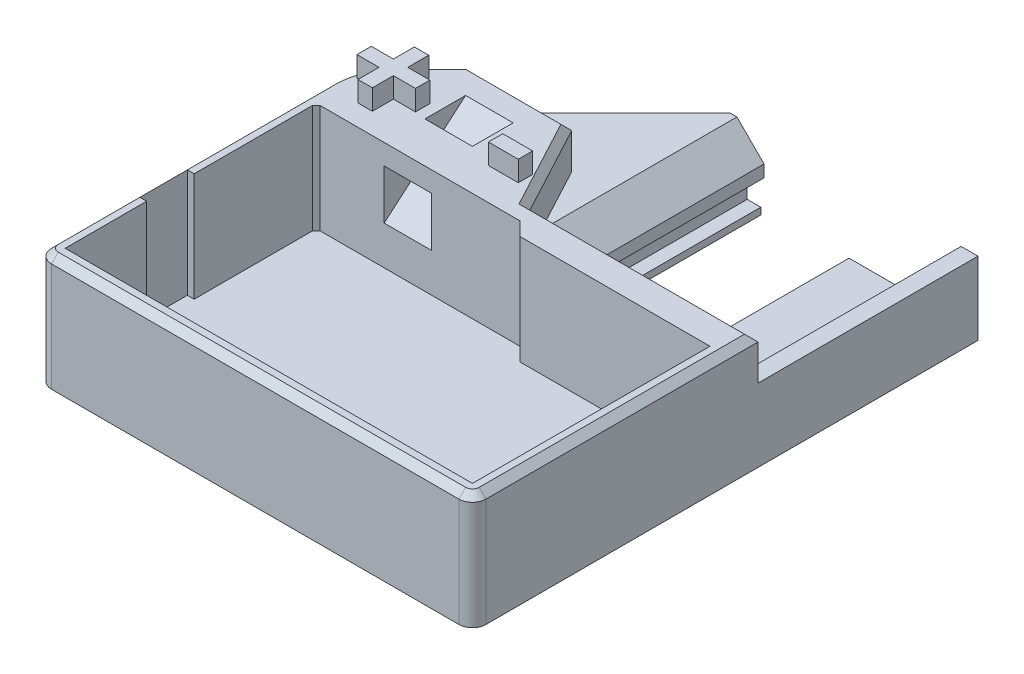
from build123d import *

# Parameters (mm, degrees)
SKETCH1_W           = 60
SKETCH1_H           = 75
BOSS_EXTRUDE1_DEPTH = 1
SKETCH2_W           = 64
SKETCH2_H           = 79
SKETCH2_W_2         = 60
SKETCH2_H_2         = 75
BOSS_EXTRUDE2_DEPTH = 17
SKETCH3_W           = 60
SKETCH3_H           = 40
BOSS_EXTRUDE3_DEPTH = 16
SKETCH4_W           = 1
SKETCH4_H           = 7
CUT_EXTRUDE1_DEPTH  = 16
CUT_LOFT2_START     = -20
CUT_LOFT2_DEPTH     = 7
SKETCH7_W           = 21.435869032
SKETCH7_H           = 2
CUT_EXTRUDE2_DEPTH  = 16
CHAMFER1_SIZE       = 10
CHAMFER2_SIZE       = 2
SKETCH9_W           = 30
SKETCH9_H           = 27.5
CUT_EXTRUDE3_DEPTH  = 14
SKETCH10_W          = 2
SKETCH10_H          = 2
BOSS_EXTRUDE5_DEPTH = 7
CUT_EXTRUDE4_DEPTH  = 54.602705156
FILLET1_R           = 10
FILLET2_R           = 10
FILLET3_R           = 2
SKETCH13_W          = 4.396153847
SKETCH13_H          = 2.116666667
BOSS_EXTRUDE7_DEPTH = 3
SKETCH14_W          = 15
SKETCH14_H          = 21.25
CUT_EXTRUDE5_DEPTH  = 52.809748118
CUT_EXTRUDE6_DEPTH  = 9
SKETCH16_W          = 15
SKETCH16_H          = 17.83101705
CUT_EXTRUDE7_DEPTH  = 54.602705156
BOSS_EXTRUDE8_REACH = 62.665
SKETCH18_W          = 40.424998059
SKETCH18_H          = 8.849345581
CUT_EXTRUDE8_DEPTH  = 54.602705156
CUT_EXTRUDE9_DEPTH  = 6.246782155
CHAMFER3_SIZE       = 1
CHAMFER4_SIZE       = 4
SKETCH20_W          = 2
SKETCH20_H          = 1
BOSS_EXTRUDE9_DEPTH = 26.984954309


# Read off the part's stored shape, not the designer's step: Cut-Loft2
# Some blends are built 0.0001 mm under size
with BuildPart() as part:
    # Sketch1 → Boss-Extrude1 (new body)
    with BuildSketch(Plane(origin=(0, 0, 0), x_dir=(1, 0, 0), z_dir=(0, 1, 0))):
        Rectangle(SKETCH1_W, SKETCH1_H)
    extrude(amount=BOSS_EXTRUDE1_DEPTH)

    # Sketch2 → Boss-Extrude2 (add)
    with BuildSketch(Plane.XZ):
        Rectangle(SKETCH2_W, SKETCH2_H)
        Rectangle(SKETCH2_W_2, SKETCH2_H_2, mode=Mode.SUBTRACT)
    extrude(amount=-BOSS_EXTRUDE2_DEPTH)

    # Sketch3 → Boss-Extrude3 (add)
    with BuildSketch(Plane(origin=(0, 1, 0), x_dir=(1, 0, 0), z_dir=(0, 1, 0))):
        with Locations((0, 17.5)):
            Rectangle(SKETCH3_W, SKETCH3_H)
    extrude(amount=BOSS_EXTRUDE3_DEPTH)

    # Sketch4 → Cut-Extrude1 (cut)
    with BuildSketch(Plane(origin=(0, 17, 0), x_dir=(1, 0, 0), z_dir=(0, 1, 0))):
        with Locations((-30.5, -22)):
            Rectangle(SKETCH4_W, SKETCH4_H)
    extrude(amount=-CUT_EXTRUDE1_DEPTH, mode=Mode.SUBTRACT)

    # Cut-Loft2 outline → Cut-Loft2 (cut)
    with BuildSketch(Plane.YZ.offset(CUT_LOFT2_START)):
        Polygon((17, -5.5), (13, 2.5), (5, 2.5), (17, -11.5), align=None)
    extrude(amount=CUT_LOFT2_DEPTH, mode=Mode.SUBTRACT)

    # Sketch7 → Cut-Extrude2 (cut)
    with BuildSketch(Plane(origin=(0, 17, 0), x_dir=(1, 0, 0), z_dir=(0, 1, 0))):
        with Locations((-10.717934516, -1.5)):
            Rectangle(SKETCH7_W, SKETCH7_H)
    extrude(amount=-CUT_EXTRUDE2_DEPTH, mode=Mode.SUBTRACT)

    # Chamfer1
    # the kernel refuses this chamfer: 10 mm, written as the material it takes off along each edge
    with BuildSketch(Plane(origin=(-21.435869032, 42.71682988, 2.5), x_dir=(-0.9996219169112968, 0, 0.02749587661058636), z_dir=(0, -1, 0))) as chamfer1_piece_1_section:
        Polygon((CHAMFER1_SIZE * 0.999621916911, CHAMFER1_SIZE * 0.0274958766106), (-CHAMFER1_SIZE * 0.0274958766106, CHAMFER1_SIZE * 0.999621916911), (0, 0), align=None)
    chamfer1_piece_1 = extrude(amount=41.71682988, mode=Mode.PRIVATE)
    chamfer1_piece_1 = split(chamfer1_piece_1, bisect_by=Plane(origin=(-30, 9, 1.507613822), z_dir=(1, 0, 0)), keep=Keep.TOP, mode=Mode.PRIVATE)
    chamfer1_piece_1 = split(chamfer1_piece_1, bisect_by=Plane(origin=(-25.679544331, 9, 0.5), z_dir=(0, 0, 1)), keep=Keep.TOP, mode=Mode.PRIVATE)
    add(chamfer1_piece_1, mode=Mode.SUBTRACT)

    # Chamfer2
    chamfer2_edges = [part.edges().sort_by_distance(p)[0] for p in [
        (0, 9, 2.5),
    ]]
    chamfer(chamfer2_edges, length=CHAMFER2_SIZE - 0.0001)  # a hair under: the kernel refuses the full size

    # Sketch9 → Cut-Extrude3 (cut)
    with BuildSketch(Plane(origin=(0, 17, 0), x_dir=(1, 0, 0), z_dir=(0, 1, 0))):
        with Locations((13, 21.75)):
            Rectangle(SKETCH9_W, SKETCH9_H)
    extrude(amount=-CUT_EXTRUDE3_DEPTH, mode=Mode.SUBTRACT)

    # Sketch10 → Boss-Extrude5 (add)
    with BuildSketch(Plane(origin=(0, 3, 0), x_dir=(1, 0, 0), z_dir=(0, 1, 0))):
        Polygon((-2, 23), (10, 23), (10, 8), (28, 8), (28, 35.5), (-2, 35.5), align=None)
        with Locations((-1, 9)):
            Rectangle(SKETCH10_W, SKETCH10_H)
    extrude(amount=BOSS_EXTRUDE5_DEPTH)

    # Sketch11 → Cut-Extrude4 (cut, through all)
    with BuildSketch(Plane(origin=(0, 17, 0), x_dir=(1, 0, 0), z_dir=(0, 1, 0))):
        Polygon((0, 39.5), (-32, 7.5), (-32, 39.5), align=None)
    extrude(amount=-CUT_EXTRUDE4_DEPTH, mode=Mode.SUBTRACT)

    # Fillet1
    fillet1_edges = [part.edges().sort_by_distance(p)[0] for p in [
        (-32, 8.5, -7.5),
    ]]
    fillet(fillet1_edges, radius=FILLET1_R)

    # Fillet2
    fillet2_edges = [part.edges().sort_by_distance(p)[0] for p in [
        (0, 8.5, -39.5),
    ]]
    fillet(fillet2_edges, radius=FILLET2_R)

    # Fillet3
    fillet3_edges = [part.edges().sort_by_distance(p)[0] for p in [
        (32, 8.5, -39.5),
        (-32, 8.5, 39.5),
        (32, 8.5, 39.5),
    ]]
    fillet(fillet3_edges, radius=FILLET3_R)

    # Sketch13 → Boss-Extrude7 (add)
    with BuildSketch(Plane(origin=(0, 17, 0), x_dir=(1, 0, 0), z_dir=(0, 1, 0))):
        Polygon((-26.96363203, 7.819559599), (-26.96363203, 10.913149343), (-24.846965364, 10.913149343), (-24.846965364, 7.819559599), (-21.590555107, 7.819559599), (-21.590555107, 5.702892932), (-24.846965364, 5.702892932), (-24.846965364, 2.609303189), (-26.96363203, 2.609303189), (-26.96363203, 5.702892932), (-30.220042287, 5.702892932), (-30.220042287, 7.819559599), align=None)
        with Locations((-7.180939722, 5.29584165)):
            Rectangle(SKETCH13_W, SKETCH13_H)
    extrude(amount=BOSS_EXTRUDE7_DEPTH)

    # Sketch14 → Cut-Extrude5 (cut, through all)
    with BuildSketch(Plane(origin=(0, 10, 0), x_dir=(1, 0, 0), z_dir=(0, 1, 0))):
        with Locations((5.5, 18.625)):
            Rectangle(SKETCH14_W, SKETCH14_H)
    extrude(amount=-CUT_EXTRUDE5_DEPTH, mode=Mode.SUBTRACT)

    # Sketch15 → Cut-Extrude6 (cut)
    with BuildSketch(Plane(origin=(0, 10, 0), x_dir=(1, 0, 0), z_dir=(0, 1, 0))):
        Polygon((-2, 29.25), (13, 29.25), (13, 8), (28, 8), (28, 35.5), (-2, 35.5), align=None)
    extrude(amount=-CUT_EXTRUDE6_DEPTH, mode=Mode.SUBTRACT)

    # Sketch16 → Cut-Extrude7 (cut, through all)
    with BuildSketch(Plane(origin=(0, 17, 0), x_dir=(1, 0, 0), z_dir=(0, 1, 0))):
        with BuildLine():
            Line((-2, 37.391398481), (-2, 35.5))
            Line((-2, 35.5), (13, 35.5))
            Line((13, 35.5), (28, 35.5))
            Line((28, 35.5), (28, 39.5))
            Line((28, 39.5), (4.142135624, 39.5))
            ThreePointArc((4.142135624, 39.5), (0.89513584, 38.958170669), (-2, 37.391398481))
        make_face()
        with BuildLine():
            Line((-2, 41.583442656), (-2, 37.391398481))
            ThreePointArc((-2, 37.391398481), (0.89513584, 38.958170669), (4.142135624, 39.5))
            Line((4.142135624, 39.5), (28, 39.5))
            Line((28, 39.5), (28, 41.583442656))
            Line((28, 41.583442656), (-2, 41.583442656))
        make_face()
        with Locations((5.5, 26.584491475)):
            Rectangle(SKETCH16_W, SKETCH16_H)
    extrude(amount=-CUT_EXTRUDE7_DEPTH, mode=Mode.SUBTRACT)

    # Boss-Extrude8: up to this face of the body (flat: up to its plane)
    boss_extrude8_end = Plane(part.part.faces().sort_by_distance((29, 8.5, -39.5))[0])
    # Sketch17 → Boss-Extrude8 (add, up to the picked face)
    with BuildSketch(Plane(origin=(0, 0, -8), x_dir=(-1, 0, 0), z_dir=(0, 0, -1)), mode=Mode.PRIVATE) as boss_extrude8_sk1:
        Polygon((-28, 2.5), (-25.515371071, 4.984628929), (-25.515371071, 10.753217845), (-28, 10.753217845), align=None)
    boss_extrude8_tool1 = split(extrude(boss_extrude8_sk1.sketch, amount=BOSS_EXTRUDE8_REACH, mode=Mode.PRIVATE), bisect_by=boss_extrude8_end, keep=Keep.BOTH, mode=Mode.PRIVATE)
    # Sketch17 → Boss-Extrude8 (add, up to the picked face)
    with BuildSketch(Plane(origin=(0, 0, -8), x_dir=(-1, 0, 0), z_dir=(0, 0, -1)), mode=Mode.PRIVATE) as boss_extrude8_sk2:
        Polygon((2, 2.5), (-0.484628929, 4.984628929), (-0.484628929, 10.753217845), (2, 10.753217845), align=None)
    boss_extrude8_tool2 = split(extrude(boss_extrude8_sk2.sketch, amount=BOSS_EXTRUDE8_REACH, mode=Mode.PRIVATE), bisect_by=boss_extrude8_end, keep=Keep.BOTH, mode=Mode.PRIVATE)
    add(boss_extrude8_tool1.solids().sort_by(Axis((26.831064, 7.211077, -8), (0, 0, -1)))[0])
    add(boss_extrude8_tool2.solids().sort_by(Axis((-0.831064, 7.211077, -8), (0, 0, -1)))[0])

    # Sketch18 → Cut-Extrude8 (cut, through all)
    with BuildSketch(Plane(origin=(0, 17, 0), x_dir=(1, 0, 0), z_dir=(0, 1, 0))):
        with Locations((11.787500971, 39.409627099)):
            Rectangle(SKETCH18_W, SKETCH18_H)
    extrude(amount=-CUT_EXTRUDE8_DEPTH, mode=Mode.SUBTRACT)

    # Sketch19 → Cut-Extrude9 (cut)
    with BuildSketch(Plane(origin=(0, 17, 0), x_dir=(1, 0, 0), z_dir=(0, 1, 0))):
        Polygon((28, 34.984954309), (28, 8), (-2, 8), (-2, 34.984954309), (-4.515045691, 34.984954309), (-23.671563877, 15.828436123), (-8.697697865, 15.828436123), (-4.515045691, 8), (-1.618603226, 2.578890647), (32, 2.578890647), (32, 34.984954309), align=None)
    extrude(amount=-CUT_EXTRUDE9_DEPTH, mode=Mode.SUBTRACT)

    # Chamfer3
    # the kernel refuses this chamfer: 1 mm, written as the material it takes off along each edge
    with BuildSketch(Plane(origin=(-21.853109397, 17, -17.646890603), x_dir=(0.7068394360706796, 0.02749587661058563, 0.7068394360706675), z_dir=(-0.7071067811865415, 0, 0.7071067811865536))) as chamfer3_piece_1:
        Polygon((CHAMFER3_SIZE * 0.999621916911, -CHAMFER3_SIZE * 0.0274958766106), (-CHAMFER3_SIZE * 0.0274958766106, -CHAMFER3_SIZE * 0.999621916911), (0, 0), align=None)
    extrude(amount=10.207734683, mode=Mode.SUBTRACT)
    with BuildSketch(Plane(origin=(-22, 17, -3.357864376), x_dir=(-0.7071067811865538, 0, -0.7071067811865412), z_dir=(0.7071067811865412, 0, -0.7071067811865538))) as chamfer3_piece_2_section:
        Polygon((10 - CHAMFER3_SIZE, 0), (10, -CHAMFER3_SIZE), (10, 0), align=None)
    chamfer3_piece_2 = revolve(axis=Axis((-22, 17, -3.357864376), (0, 1, 0)), revolution_arc=45, mode=Mode.PRIVATE)
    chamfer3_piece_2 = split(chamfer3_piece_2, bisect_by=Plane(origin=(-29.540972518, 16.686713644, -7.819559599), z_dir=(0, 0, -1)), keep=Keep.TOP, mode=Mode.PRIVATE)
    chamfer3_piece_2 = split(chamfer3_piece_2, bisect_by=Plane(origin=(-30.220042287, 16.686713644, -9.324246754), z_dir=(1, 0, 0)), keep=Keep.TOP, mode=Mode.PRIVATE)
    add(chamfer3_piece_2, mode=Mode.SUBTRACT)
    with BuildSketch(Plane(origin=(-22, 17, -3.357864376), x_dir=(-0.7071067811865538, 0, -0.7071067811865412), z_dir=(0.7071067811865412, 0, -0.7071067811865538))) as chamfer3_piece_3_section:
        Polygon((10 - CHAMFER3_SIZE, 0), (10, -CHAMFER3_SIZE), (10, 0), align=None)
    chamfer3_piece_3 = revolve(axis=Axis((-22, 17, -3.357864376), (0, 1, 0)), revolution_arc=45, mode=Mode.PRIVATE)
    chamfer3_piece_3 = split(chamfer3_piece_3, bisect_by=Plane(origin=(-30.497975993, 16.585042802, -7.819559599), z_dir=(0, 0, -1)), keep=Keep.TOP, mode=Mode.PRIVATE)
    chamfer3_piece_3 = split(chamfer3_piece_3, bisect_by=Plane(origin=(-30.220042287, 16.585042802, -8.286119393), z_dir=(-1, 0, 0)), keep=Keep.TOP, mode=Mode.PRIVATE)
    add(chamfer3_piece_3, mode=Mode.SUBTRACT)
    with BuildSketch(Plane(origin=(-22, 17, -3.357864376), x_dir=(-0.7071067811865538, 0, -0.7071067811865412), z_dir=(0.7071067811865412, 0, -0.7071067811865538))) as chamfer3_piece_4_section:
        Polygon((10 - CHAMFER3_SIZE, 0), (10, -CHAMFER3_SIZE), (10, 0), align=None)
    chamfer3_piece_4 = revolve(axis=Axis((-22, 17, -3.357864376), (0, 1, 0)), revolution_arc=45, mode=Mode.PRIVATE)
    chamfer3_piece_4 = split(chamfer3_piece_4, bisect_by=Plane(origin=(-31.314504081, 16.6678644, -7.819559599), z_dir=(0, 0, 1)), keep=Keep.TOP, mode=Mode.PRIVATE)
    chamfer3_piece_4 = split(chamfer3_piece_4, bisect_by=Plane(origin=(-30.220042287, 16.6678644, -5.613397868), z_dir=(-1, 0, 0)), keep=Keep.TOP, mode=Mode.PRIVATE)
    add(chamfer3_piece_4, mode=Mode.SUBTRACT)
    with BuildSketch(Plane(origin=(30, 17, 39.5), x_dir=(0, 0.02749587661058555, -0.9996219169112968), z_dir=(-1, 0, 0))) as chamfer3_piece_5:
        Polygon((CHAMFER3_SIZE * 0.999621916911, CHAMFER3_SIZE * 0.0274958766106), (-CHAMFER3_SIZE * 0.0274958766106, CHAMFER3_SIZE * 0.999621916911), (0, 0), align=None)
    extrude(amount=60, mode=Mode.SUBTRACT)
    with BuildSketch(Plane(origin=(-32, 17, 37.5), x_dir=(0.9996219169112968, 0.027495876610585647, 0), z_dir=(0, 0, -1))) as chamfer3_piece_6:
        Polygon((CHAMFER3_SIZE * 0.999621916911, CHAMFER3_SIZE * 0.0274958766106), (-CHAMFER3_SIZE * 0.0274958766106, CHAMFER3_SIZE * 0.999621916911), (0, 0), align=None)
    extrude(amount=40.857864376, mode=Mode.SUBTRACT)
    with BuildSketch(Plane(origin=(30, 17, 37.5), x_dir=(1, 0, 0), z_dir=(0, 0, -1))) as chamfer3_piece_7:
        Polygon((2 - CHAMFER3_SIZE, 0), (2, CHAMFER3_SIZE), (2, 0), align=None)
    revolve(axis=Axis((30, 17, 37.5), (0, -1, 0)), revolution_arc=90, mode=Mode.SUBTRACT)
    with BuildSketch(Plane(origin=(-30, 17, 37.5), x_dir=(-1, 0, 0), z_dir=(0, 0, -1))) as chamfer3_piece_8:
        Polygon((2 - CHAMFER3_SIZE, 0), (2, -CHAMFER3_SIZE), (2, 0), align=None)
    revolve(axis=Axis((-30, 17, 37.5), (0, 1, 0)), revolution_arc=90, mode=Mode.SUBTRACT)
    with BuildSketch(Plane(origin=(32, 17, -5.150573635), x_dir=(-0.9996219169112968, 0.027495876610585647, 0), z_dir=(0, 0, 1))) as chamfer3_piece_9:
        Polygon((CHAMFER3_SIZE * 0.999621916911, CHAMFER3_SIZE * 0.0274958766106), (-CHAMFER3_SIZE * 0.0274958766106, CHAMFER3_SIZE * 0.999621916911), (0, 0), align=None)
    extrude(amount=42.650573635, mode=Mode.SUBTRACT)
    with BuildSketch(Plane(origin=(-26.243246865, 17, -15.828436123), x_dir=(0, 0.027495876610585647, 0.9996219169112968), z_dir=(1, 0, 0))) as chamfer3_piece_10:
        Polygon((CHAMFER3_SIZE * 0.999621916911, CHAMFER3_SIZE * 0.0274958766106), (-CHAMFER3_SIZE * 0.0274958766106, CHAMFER3_SIZE * 0.999621916911), (0, 0), align=None)
    extrude(amount=20.117231987, mode=Mode.SUBTRACT)
    with BuildSketch(Plane(origin=(-0.40671107, 17, -0.310659884), x_dir=(-0.8816690057056329, 0.02749587661058563, 0.47106659948191654), z_dir=(-0.4712447691597757, 0, -0.8820024759259748))) as chamfer3_piece_11_section:
        Polygon((CHAMFER3_SIZE * 0.999621916911, -CHAMFER3_SIZE * 0.0274958766106), (-CHAMFER3_SIZE * 0.0274958766106, -CHAMFER3_SIZE * 0.999621916911), (0, 0), align=None)
    chamfer3_piece_11 = extrude(amount=20.16548421, mode=Mode.PRIVATE)
    chamfer3_piece_11 = split(chamfer3_piece_11, bisect_by=Plane(origin=(-6.094530001, 16.669164986, -2.578890647), z_dir=(0, 0, -1)), keep=Keep.TOP, mode=Mode.PRIVATE)
    add(chamfer3_piece_11, mode=Mode.SUBTRACT)
    with BuildSketch(Plane(origin=(-4.190286214, 17, -2.578890647), x_dir=(0, 0.02749587661058563, 0.9996219169112968), z_dir=(1, 0, 0))) as chamfer3_piece_12_section:
        Polygon((CHAMFER3_SIZE * 0.999621916911, CHAMFER3_SIZE * 0.0274958766106), (-CHAMFER3_SIZE * 0.0274958766106, CHAMFER3_SIZE * 0.999621916911), (0, 0), align=None)
    chamfer3_piece_12 = extrude(amount=38.761969201, mode=Mode.PRIVATE)
    chamfer3_piece_12 = split(chamfer3_piece_12, bisect_by=Plane(origin=(2.556007493, 16.669702724, 5.234494733), z_dir=(0.8820024759259748, 0, -0.47124476915977576)), keep=Keep.TOP, mode=Mode.PRIVATE)
    add(chamfer3_piece_12, mode=Mode.SUBTRACT)
    with BuildSketch(Plane(origin=(-4.190286214, 17, -2.578890647), x_dir=(0, 0.02749587661058563, 0.9996219169112968), z_dir=(1, 0, 0))) as chamfer3_piece_13a_section:
        Polygon((CHAMFER3_SIZE * 0.999621916911, CHAMFER3_SIZE * 0.0274958766106), (-CHAMFER3_SIZE * 0.0274958766106, CHAMFER3_SIZE * 0.999621916911), (0, 0), align=None)
    chamfer3_piece_13a = extrude(amount=38.761969201, mode=Mode.PRIVATE)
    chamfer3_piece_13a = split(chamfer3_piece_13a, bisect_by=Plane(origin=(-1.74164745, 16.676807244, -2.80918564), z_dir=(-0.8820024759259748, 0, 0.47124476915977576)), keep=Keep.TOP, mode=Mode.PRIVATE)
    with BuildSketch(Plane(origin=(-0.40671107, 17, -0.310659884), x_dir=(-0.8816690057056329, 0.02749587661058563, 0.47106659948191654), z_dir=(-0.4712447691597757, 0, -0.8820024759259748))) as chamfer3_piece_13b_section:
        Polygon((CHAMFER3_SIZE * 0.999621916911, -CHAMFER3_SIZE * 0.0274958766106), (-CHAMFER3_SIZE * 0.0274958766106, -CHAMFER3_SIZE * 0.999621916911), (0, 0), align=None)
    chamfer3_piece_13b = extrude(amount=20.16548421, mode=Mode.PRIVATE)
    chamfer3_piece_13b = split(chamfer3_piece_13b, bisect_by=Plane(origin=(-1.357498525, 16.676807244, -2.578890647), z_dir=(0, 0, 1)), keep=Keep.TOP, mode=Mode.PRIVATE)
    chamfer3_piece_13 = chamfer3_piece_13a & chamfer3_piece_13b
    add(chamfer3_piece_13, mode=Mode.SUBTRACT)

    # Chamfer4
    # the kernel refuses this chamfer: 4 mm, written as the material it takes off along each edge
    with BuildSketch(Plane(origin=(0.484628929, 10.753217845, -8), x_dir=(0.02749587660983432, -0.9996219169113173, 0), z_dir=(0, 0, -1))) as chamfer4_piece_1:
        Polygon((CHAMFER4_SIZE * 0.999621916911, CHAMFER4_SIZE * 0.0274958766098), (-CHAMFER4_SIZE * 0.0274958766631, CHAMFER4_SIZE * 0.99962191691), (0, 0), align=None)
    extrude(amount=37.271686261, mode=Mode.SUBTRACT)
    with BuildSketch(Plane(origin=(25.515371071, 10.753217845, -8), x_dir=(-0.027495876609834723, -0.9996219169113173, 0), z_dir=(0, 0, -1))) as chamfer4_piece_2:
        Polygon((CHAMFER4_SIZE * 0.999621916911, -CHAMFER4_SIZE * 0.0274958766098), (-CHAMFER4_SIZE * 0.0274958766631, -CHAMFER4_SIZE * 0.99962191691), (0, 0), align=None)
    extrude(amount=37.271686261, mode=Mode.SUBTRACT)
    with BuildSketch(Plane(origin=(25.515371071, 10.753217845, -8), x_dir=(0, -0.9996219169112968, -0.027495876610586494), z_dir=(-1, 0, 0))) as chamfer4_piece_3:
        Polygon((CHAMFER4_SIZE * 0.999621916911, CHAMFER4_SIZE * 0.0274958766106), (-CHAMFER4_SIZE * 0.0274958766106, CHAMFER4_SIZE * 0.999621916911), (0, 0), align=None)
    extrude(amount=25.030742141, mode=Mode.SUBTRACT)
    with BuildSketch(Plane(origin=(25.515371071, 10.753217845, -8), x_dir=(0, -0.9996219169112968, -0.027495876610586494), z_dir=(-1, 0, 0))) as chamfer4_piece_4a_section:
        Polygon((CHAMFER4_SIZE * 0.999621916911, CHAMFER4_SIZE * 0.0274958766106), (-CHAMFER4_SIZE * 0.0274958766106, CHAMFER4_SIZE * 0.999621916911), (0, 0), align=None)
    chamfer4_piece_4a = extrude(amount=35.317474093, mode=Mode.PRIVATE)
    chamfer4_piece_4a = split(chamfer4_piece_4a, bisect_by=Plane(origin=(-3.393376338, 9.366470533, -5.900634211), z_dir=(0.8820024759259748, 0, -0.47124476915977576)), keep=Keep.TOP, mode=Mode.PRIVATE)
    chamfer4_piece_4a = split(chamfer4_piece_4a, bisect_by=Plane(origin=(0.484628929, 9.366470533, -6.807223288), z_dir=(-1, 0, 0)), keep=Keep.TOP, mode=Mode.PRIVATE)
    with BuildSketch(Plane(origin=(0.484628929, 10.753217845, 2.286731952), x_dir=(0.027495876610586358, -0.9996219169112968, 0), z_dir=(0, 0, -1))) as chamfer4_piece_4b_section:
        Polygon((CHAMFER4_SIZE * 0.999621916911, CHAMFER4_SIZE * 0.0274958766106), (-CHAMFER4_SIZE * 0.0274958766106, CHAMFER4_SIZE * 0.999621916911), (0, 0), align=None)
    chamfer4_piece_4b = extrude(amount=47.558418213, mode=Mode.PRIVATE)
    chamfer4_piece_4b = split(chamfer4_piece_4b, bisect_by=Plane(origin=(-2.589795619, 9.377652702, -4.396617127), z_dir=(0.8820024759259748, 0, -0.47124476915977576)), keep=Keep.TOP, mode=Mode.PRIVATE)
    chamfer4_piece_4b = split(chamfer4_piece_4b, bisect_by=Plane(origin=(-0.726846109, 9.377652702, -2.578890647), z_dir=(0, 0, -1)), keep=Keep.TOP, mode=Mode.PRIVATE)
    chamfer4_piece_4b = split(chamfer4_piece_4b, bisect_by=Plane(origin=(-0.726846109, 9.377652702, -8), z_dir=(0, 0, 1)), keep=Keep.TOP, mode=Mode.PRIVATE)
    chamfer4_piece_4 = chamfer4_piece_4a & chamfer4_piece_4b
    add(chamfer4_piece_4, mode=Mode.SUBTRACT)
    with BuildSketch(Plane(origin=(35.802103022, 10.753217845, -8), x_dir=(0, -0.9996219169112968, -0.027495876610586494), z_dir=(-1, 0, 0))) as chamfer4_piece_5a_section:
        Polygon((CHAMFER4_SIZE * 0.999621916911, CHAMFER4_SIZE * 0.0274958766106), (-CHAMFER4_SIZE * 0.0274958766106, CHAMFER4_SIZE * 0.999621916911), (0, 0), align=None)
    chamfer4_piece_5a = extrude(amount=35.317474093, mode=Mode.PRIVATE)
    chamfer4_piece_5a = split(chamfer4_piece_5a, bisect_by=Plane(origin=(25.515371071, 9.434043338, -6.680825493), z_dir=(1, 0, 0)), keep=Keep.TOP, mode=Mode.PRIVATE)
    with BuildSketch(Plane(origin=(25.515371071, 10.753217845, 2.286731952), x_dir=(-0.027495876610586494, -0.9996219169112968, 0), z_dir=(0, 0, -1))) as chamfer4_piece_5b_section:
        Polygon((CHAMFER4_SIZE * 0.999621916911, -CHAMFER4_SIZE * 0.0274958766106), (-CHAMFER4_SIZE * 0.0274958766106, -CHAMFER4_SIZE * 0.999621916911), (0, 0), align=None)
    chamfer4_piece_5b = extrude(amount=47.558418213, mode=Mode.PRIVATE)
    chamfer4_piece_5b = split(chamfer4_piece_5b, bisect_by=Plane(origin=(26.834545578, 9.434043338, -2.578890647), z_dir=(0, 0, -1)), keep=Keep.TOP, mode=Mode.PRIVATE)
    chamfer4_piece_5b = split(chamfer4_piece_5b, bisect_by=Plane(origin=(26.834545578, 9.434043338, -8), z_dir=(0, 0, 1)), keep=Keep.TOP, mode=Mode.PRIVATE)
    chamfer4_piece_5 = chamfer4_piece_5a & chamfer4_piece_5b
    add(chamfer4_piece_5, mode=Mode.SUBTRACT)

    # Sketch20 → Boss-Extrude9 (add)
    with BuildSketch(Plane(origin=(0, 0, -34.984954309), x_dir=(-1, 0, 0), z_dir=(0, 0, -1))):
        with Locations((1, 0.5)):
            Rectangle(SKETCH20_W, SKETCH20_H)
    extrude(amount=-BOSS_EXTRUDE9_DEPTH)


solid = part.part
